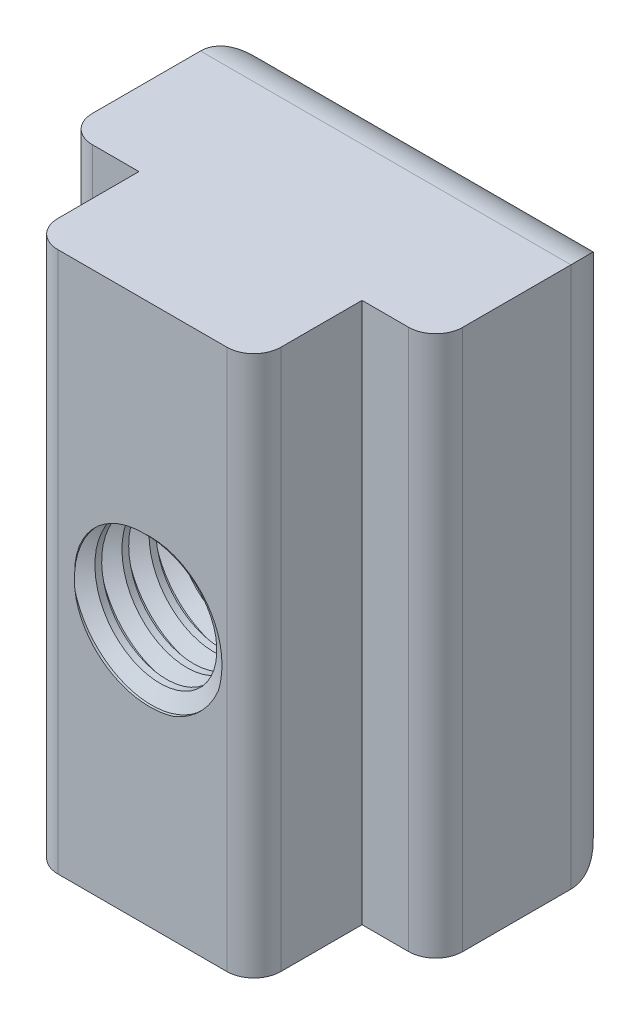
from build123d import *

# Parameters (mm, degrees)
SKETCH1_W           = 8.25
SKETCH1_H           = 4
BOSS_EXTRUDE1_DEPTH = 20
SKETCH2_R           = 2.5
CUT_EXTRUDE1_DEPTH  = 26.326875548
THREAD1_PITCH       = 1
FILLET1_R           = 2
FILLET2_R           = 1


with BuildPart() as part:
    # Sketch1 → Boss-Extrude1 (new body)
    with BuildSketch(Plane(origin=(0, 0, 0), x_dir=(1, 0, 0), z_dir=(0, 1, 0))):
        with Locations((-4.125, 2)):
            Rectangle(SKETCH1_W, SKETCH1_H)
        Polygon((-8.25, 4), (0, 4), (2.725, 4), (2.725, 11), (-10.975, 11), (-10.975, 4), align=None)
    extrude(amount=BOSS_EXTRUDE1_DEPTH)

    # Sketch2 → Cut-Extrude1 (cut, through all)
    with BuildSketch(Plane.XY):
        with Locations((-4.125, 10)):
            Circle(SKETCH2_R)
    extrude(amount=-CUT_EXTRUDE1_DEPTH, mode=Mode.SUBTRACT)

    # Thread1: the profile of Thread Profile1 profile screwed along a right-hand helix of 12 turns, 8 arcs to a turn; built about Z, then put on its axis
    thread1_z = Axis((0, 0, 0), (0, 0, 1))
    thread1_corners = [(2.4997, 0, -0.000173205), (3.041265875, 0, 0.312499999), (3.041265875, 0, 0.437499999), (2.4997, 0, 0.750173202)]
    with BuildLine(mode=Mode.PRIVATE) as thread1_profile:
        Line(thread1_corners[0], thread1_corners[1])
        Line(thread1_corners[1], thread1_corners[2])
        Line(thread1_corners[2], thread1_corners[3])
        Line(thread1_corners[3], thread1_corners[0])
    thread1_cap = Face(thread1_profile.wire())
    thread1_turn_angles = [0, 22.5, 45, 67.5, 90, 112.5, 135, 157.5, 180, 202.5, 225, 247.5, 270, 292.5, 315, 337.5, 360]
    thread1_turn_weights = [1, 0.9238795325112867, 1, 0.9238795325112867, 1, 0.9238795325112867, 1, 0.9238795325112867, 1, 0.9238795325112867, 1, 0.9238795325112867, 1, 0.9238795325112867, 1, 0.9238795325112867, 1]
    thread1_turn_rails = [Edge.make_bspline([Vector(p[0], p[1], 0).rotate(thread1_z, thread1_turn_angles[k]) / thread1_turn_weights[k] + Vector(0, 0, p[2] + THREAD1_PITCH * thread1_turn_angles[k] / 360) for k in range(17)], [0, 0, 0, 1, 1, 2, 2, 3, 3, 4, 4, 5, 5, 6, 6, 7, 7, 8, 8, 8], 2, thread1_turn_weights) for p in thread1_corners]
    thread1_turn_sides = [Face.make_surface_from_curves(thread1_turn_rails[p[0]], thread1_turn_rails[p[1]]) for p in [(0, 1), (1, 2), (2, 3), (3, 0)]]
    thread1 = Plane(origin=(-4.125, 10, 1), x_dir=(-1, 0, 0), z_dir=(0, 0, -1)) * Solid(Shell([*[p.moved(Location((0, 0, THREAD1_PITCH * i))) for i in range(12) for p in thread1_turn_sides], thread1_cap, thread1_cap.rotate(thread1_z, 4320).moved(Location((0, 0, THREAD1_PITCH * 4320 / 360)))]))
    add(thread1, mode=Mode.SUBTRACT)

    # Fillet1
    fillet1_edges = [part.edges().sort_by_distance(p)[0] for p in [
        (-4.125, 0, -11),
        (-10.975, 10, -11),
        (2.725, 10, -11),
        (-4.125, 20, -11),
    ]]
    fillet(fillet1_edges, radius=FILLET1_R)

    # Fillet2
    fillet2_edges = [part.edges().sort_by_distance(p)[0] for p in [
        (-10.975, 10, -4),
        (2.725, 10, -4),
        (0, 10, 0),
        (-8.25, 10, 0),
    ]]
    fillet(fillet2_edges, radius=FILLET2_R)


solid = part.part
